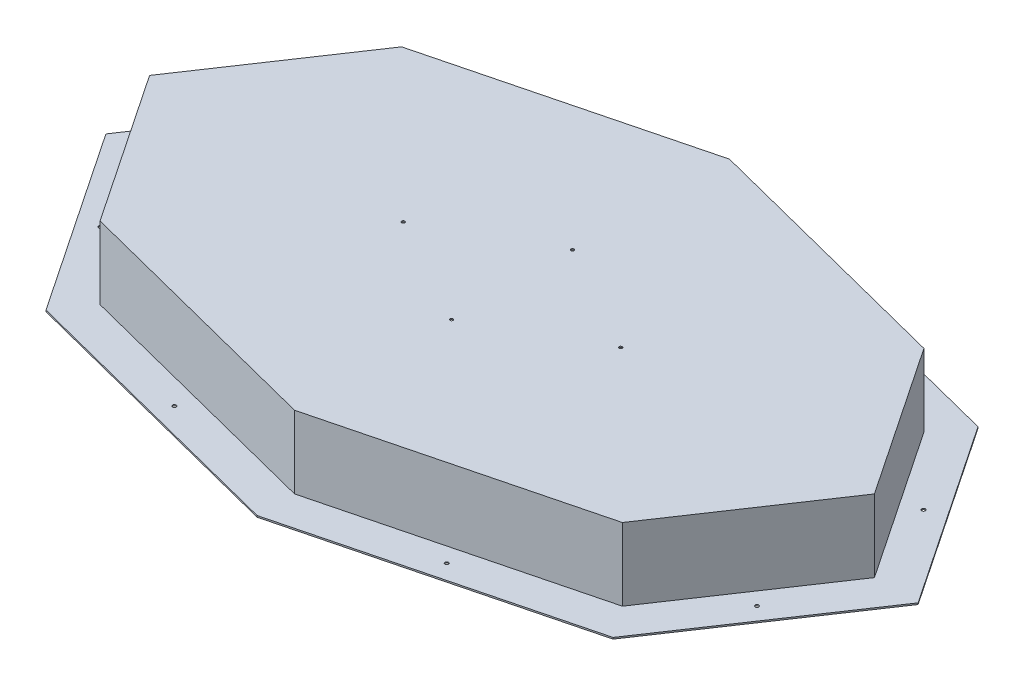
from build123d import *

# Parameters (mm, degrees)
BOSS_EXTRUDE1_DEPTH   = 152.4
BOSS_EXTRUDE2_DEPTH   = 3.175
SHELL1_T              = -2.38125
SKETCH3_R             = 3.175
CUT_EXTRUDE1_DEPTH    = 1020.94798284
CRVPATTERN1_START     = 150.01875
CRVPATTERN1_OUTLINE_R = 3.175
CRVPATTERN1_DEPTH     = 2.38125
CUT_EXTRUDE2_REACH    = 1021.469
SKETCH5_R             = 3.81


# Read off the part's stored shape, not the designer's step: CrvPattern1
with BuildPart() as part:
    # Sketch1 → Boss-Extrude1 (new body)
    with BuildSketch(Plane(origin=(0, 0, 0), x_dir=(1, 0, 0), z_dir=(0, 1, 0))):
        Polygon((-549.079439398, 317.011162143), (0, 457.2), (549.079439398, 317.011162143), (762, 0), (549.079439398, -317.011162143), (0, -457.2), (-549.079439398, -317.011162143), (-762, 0), align=None)
    extrude(amount=BOSS_EXTRUDE1_DEPTH)

    # Sketch2 → Boss-Extrude2 (add)
    with BuildSketch(Plane.XZ):
        Polygon((0, 535.844392641), (-596.116107134, 383.646334781), (-853.792184287, 0), (-596.116107134, -383.646334781), (0, -535.844392641), (596.116107134, -383.646334781), (853.792184287, 0), (596.116107134, 383.646334781), align=None)
    extrude(amount=BOSS_EXTRUDE2_DEPTH)

    # Shell1
    shell1_openings = [part.faces().sort_by_distance(p)[0] for p in [
        (0, -3.175, 0),
    ]]
    offset(amount=SHELL1_T, openings=shell1_openings, kind=Kind.INTERSECTION)

    # Sketch3 → Cut-Extrude1 (cut, through all)
    with BuildSketch(Plane(origin=(0, 152.4, 0), x_dir=(1, 0, 0), z_dir=(0, 1, 0))):
        with Locations(Location((0, 127, 0), (0, 0, 270))):
            Circle(SKETCH3_R)
    extrude(amount=-CUT_EXTRUDE1_DEPTH, mode=Mode.SUBTRACT)

    # CrvPattern1 outline → CrvPattern1 (cut)
    with BuildSketch(Plane(origin=(0, 0, 0), x_dir=(1, 0, 0), z_dir=(0, 1, 0)).offset(CRVPATTERN1_START)):
        with Locations((-228.6, 0)):
            Circle(CRVPATTERN1_OUTLINE_R)
        with Locations((0, -127)):
            Circle(CRVPATTERN1_OUTLINE_R)
        with Locations((228.6, 0)):
            Circle(CRVPATTERN1_OUTLINE_R)
    extrude(amount=CRVPATTERN1_DEPTH, mode=Mode.SUBTRACT)

    # Sketch5 → Cut-Extrude2 (cut, up to next)
    with BuildSketch(Plane(origin=(0, 0, 0), x_dir=(1, 0, 0), z_dir=(0, 1, 0)), mode=Mode.PRIVATE) as cut_extrude2_sk1:
        with Locations(Location((-286.298886633, 423.425472391, 0), (0, 0, 270))):
            Circle(SKETCH5_R)
    cut_extrude2_tool1 = extrude(cut_extrude2_sk1.sketch, amount=-CUT_EXTRUDE2_REACH, mode=Mode.PRIVATE) & part.part
    # Sketch5 → Cut-Extrude2 (cut, up to next)
    with BuildSketch(Plane(origin=(0, 0, 0), x_dir=(1, 0, 0), z_dir=(0, 1, 0)), mode=Mode.PRIVATE) as cut_extrude2_sk2:
        with Locations(Location((-690.246932705, 175.164374231, 0), (0, 0, 270))):
            Circle(SKETCH5_R)
    cut_extrude2_tool2 = extrude(cut_extrude2_sk2.sketch, amount=-CUT_EXTRUDE2_REACH, mode=Mode.PRIVATE) & part.part
    # Sketch5 → Cut-Extrude2 (cut, up to next)
    with BuildSketch(Plane(origin=(0, 0, 0), x_dir=(1, 0, 0), z_dir=(0, 1, 0)), mode=Mode.PRIVATE) as cut_extrude2_sk3:
        with Locations(Location((-690.246932705, -175.164374231, 0), (0, 0, 270))):
            Circle(SKETCH5_R)
    cut_extrude2_tool3 = extrude(cut_extrude2_sk3.sketch, amount=-CUT_EXTRUDE2_REACH, mode=Mode.PRIVATE) & part.part
    # Sketch5 → Cut-Extrude2 (cut, up to next)
    with BuildSketch(Plane(origin=(0, 0, 0), x_dir=(1, 0, 0), z_dir=(0, 1, 0)), mode=Mode.PRIVATE) as cut_extrude2_sk4:
        with Locations(Location((-286.298886633, -423.425472391, 0), (0, 0, 270))):
            Circle(SKETCH5_R)
    cut_extrude2_tool4 = extrude(cut_extrude2_sk4.sketch, amount=-CUT_EXTRUDE2_REACH, mode=Mode.PRIVATE) & part.part
    # Sketch5 → Cut-Extrude2 (cut, up to next)
    with BuildSketch(Plane(origin=(0, 0, 0), x_dir=(1, 0, 0), z_dir=(0, 1, 0)), mode=Mode.PRIVATE) as cut_extrude2_sk5:
        with Locations(Location((286.298886633, -423.425472391, 0), (0, 0, 270))):
            Circle(SKETCH5_R)
    cut_extrude2_tool5 = extrude(cut_extrude2_sk5.sketch, amount=-CUT_EXTRUDE2_REACH, mode=Mode.PRIVATE) & part.part
    # Sketch5 → Cut-Extrude2 (cut, up to next)
    with BuildSketch(Plane(origin=(0, 0, 0), x_dir=(1, 0, 0), z_dir=(0, 1, 0)), mode=Mode.PRIVATE) as cut_extrude2_sk6:
        with Locations(Location((690.246932705, -175.164374231, 0), (0, 0, 270))):
            Circle(SKETCH5_R)
    cut_extrude2_tool6 = extrude(cut_extrude2_sk6.sketch, amount=-CUT_EXTRUDE2_REACH, mode=Mode.PRIVATE) & part.part
    # Sketch5 → Cut-Extrude2 (cut, up to next)
    with BuildSketch(Plane(origin=(0, 0, 0), x_dir=(1, 0, 0), z_dir=(0, 1, 0)), mode=Mode.PRIVATE) as cut_extrude2_sk7:
        with Locations(Location((690.246932705, 175.164374231, 0), (0, 0, 270))):
            Circle(SKETCH5_R)
    cut_extrude2_tool7 = extrude(cut_extrude2_sk7.sketch, amount=-CUT_EXTRUDE2_REACH, mode=Mode.PRIVATE) & part.part
    # Sketch5 → Cut-Extrude2 (cut, up to next)
    with BuildSketch(Plane(origin=(0, 0, 0), x_dir=(1, 0, 0), z_dir=(0, 1, 0)), mode=Mode.PRIVATE) as cut_extrude2_sk8:
        with Locations(Location((286.298886633, 423.425472391, 0), (0, 0, 270))):
            Circle(SKETCH5_R)
    cut_extrude2_tool8 = extrude(cut_extrude2_sk8.sketch, amount=-CUT_EXTRUDE2_REACH, mode=Mode.PRIVATE) & part.part
    add(cut_extrude2_tool1.solids().sort_by_distance((-286.298887, 0, -423.425472))[0], mode=Mode.SUBTRACT)
    add(cut_extrude2_tool2.solids().sort_by_distance((-690.246933, 0, -175.164374))[0], mode=Mode.SUBTRACT)
    add(cut_extrude2_tool3.solids().sort_by_distance((-690.246933, 0, 175.164374))[0], mode=Mode.SUBTRACT)
    add(cut_extrude2_tool4.solids().sort_by_distance((-286.298887, 0, 423.425472))[0], mode=Mode.SUBTRACT)
    add(cut_extrude2_tool5.solids().sort_by_distance((286.298887, 0, 423.425472))[0], mode=Mode.SUBTRACT)
    add(cut_extrude2_tool6.solids().sort_by_distance((690.246933, 0, 175.164374))[0], mode=Mode.SUBTRACT)
    add(cut_extrude2_tool7.solids().sort_by_distance((690.246933, 0, -175.164374))[0], mode=Mode.SUBTRACT)
    add(cut_extrude2_tool8.solids().sort_by_distance((286.298887, 0, -423.425472))[0], mode=Mode.SUBTRACT)


solid = part.part
